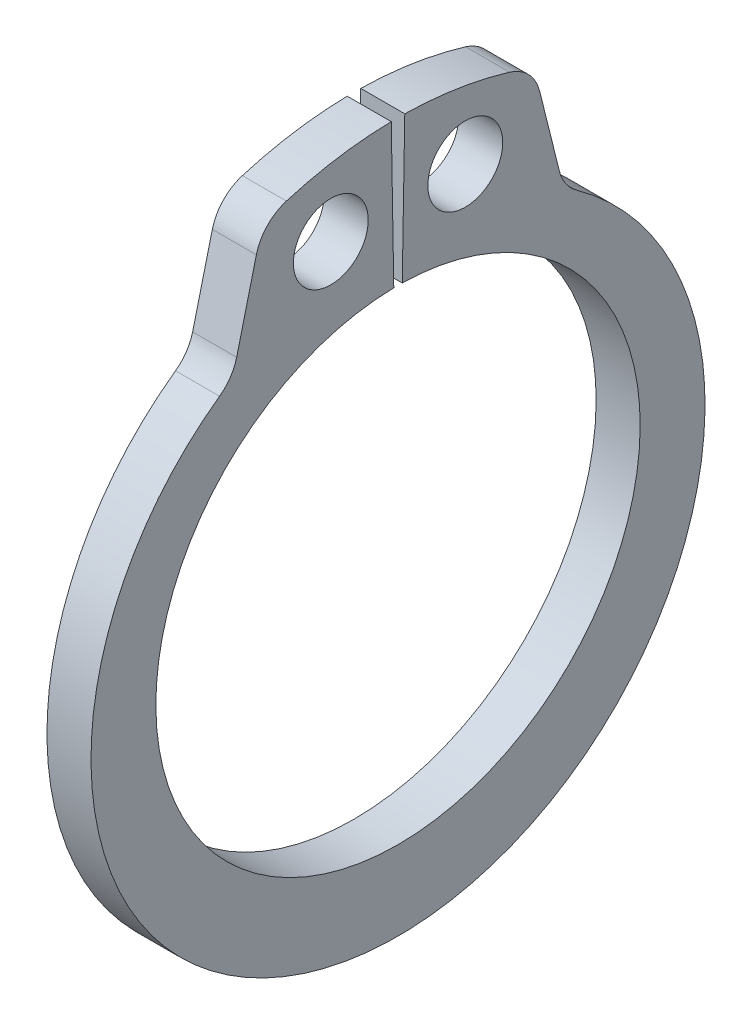
from build123d import *

# Parameters (mm, degrees)
SKETCH1_R      = 0.85
EXTRUDE1_DEPTH = 0.5
FILLET1_R      = 1


with BuildPart() as part:
    # Sketch1 → Extrude1 (new, symmetric)
    with BuildSketch(Plane(origin=(0, 0, 0), x_dir=(0, 0, -1), z_dir=(1, 0, 0))):
        with BuildLine():
            Line((-0.095988235, 5.499162323), (-0.153581177, 8.798659717))
            ThreePointArc((-0.153581177, 8.798659717), (-1.643106536, 8.645241518), (-3.085056855, 8.241506185))
            Line((-3.085056855, 8.241506185), (-3.756691586, 5.54772641))
            ThreePointArc((-3.756691586, 5.54772641), (0, -7.3), (3.756691586, 5.54772641))
            Line((3.756691586, 5.54772641), (3.085056855, 8.241506185))
            ThreePointArc((3.085056855, 8.241506185), (1.643106536, 8.645241518), (0.153581177, 8.798659717))
            Line((0.153581177, 8.798659717), (0.095988235, 5.499162323))
            ThreePointArc((0.095988235, 5.499162323), (0, -5.5), (-0.095988235, 5.499162323))
        make_face()
        with Locations((-1.527168783, 7.124432315)):
            Circle(SKETCH1_R, mode=Mode.SUBTRACT)
        with Locations((1.527168783, 7.124432315)):
            Circle(SKETCH1_R, mode=Mode.SUBTRACT)
    extrude(amount=EXTRUDE1_DEPTH, both=True)

    # Fillet1
    fillet1_edges = [part.edges().sort_by_distance(p)[0] for p in [
        (0, 5.54772641, 3.756691586),
        (0, 8.241506185, 3.085056855),
        (0, 8.241506185, -3.085056855),
        (0, 5.54772641, -3.756691586),
    ]]
    fillet(fillet1_edges, radius=FILLET1_R)


solid = part.part
